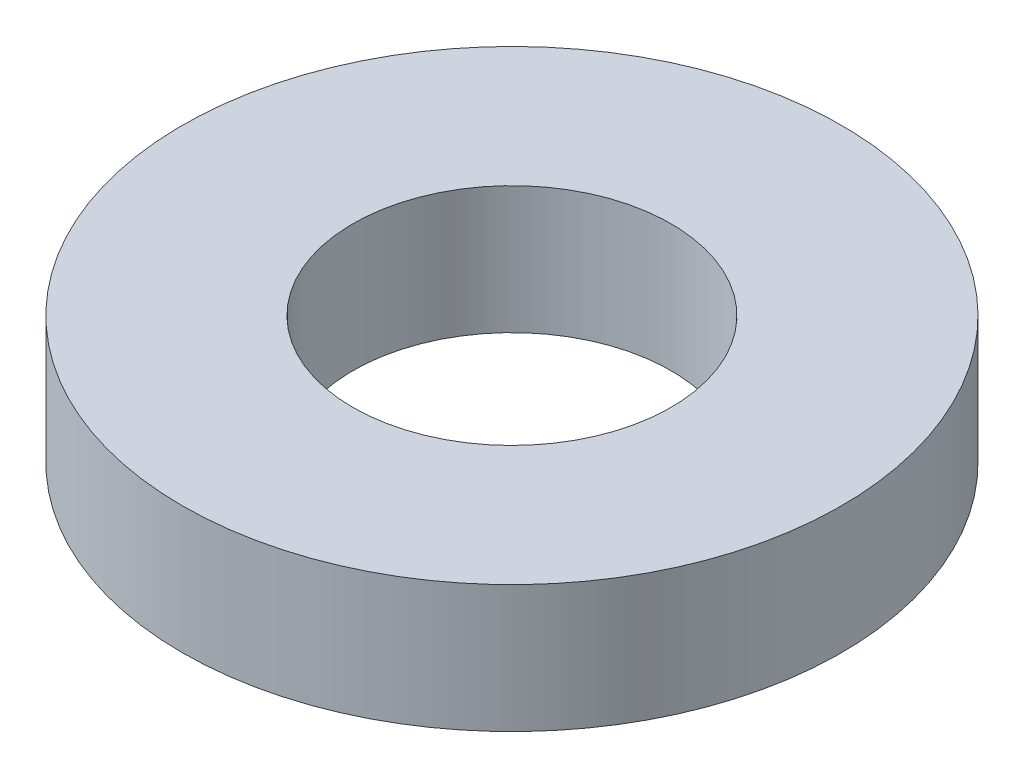
from build123d import *

# Parameters (mm, degrees)
SKETCH1_R           = 72.5
BOSS_EXTRUDE1_DEPTH = 28
SKETCH2_R           = 35
CUT_EXTRUDE1_DEPTH  = 107.284994237


with BuildPart() as part:
    # Sketch1 → Boss-Extrude1 (new body)
    with BuildSketch(Plane(origin=(0, 0, 0), x_dir=(1, 0, 0), z_dir=(0, 1, 0))):
        Circle(SKETCH1_R)
    extrude(amount=BOSS_EXTRUDE1_DEPTH)

    # Sketch2 → Cut-Extrude1 (cut, through all)
    with BuildSketch(Plane(origin=(0, 0, 0), x_dir=(1, 0, 0), z_dir=(0, 1, 0))):
        Circle(SKETCH2_R)
    extrude(amount=CUT_EXTRUDE1_DEPTH, mode=Mode.SUBTRACT)


solid = part.part
